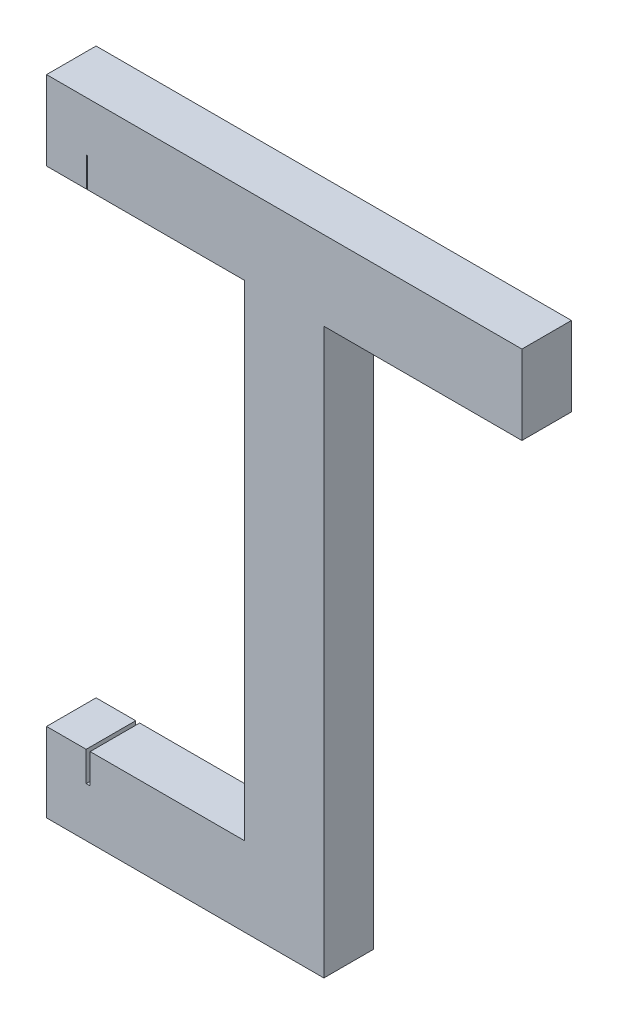
from build123d import *

# Parameters (mm, degrees)
BOSS_EXTRUDE1_DEPTH = 5
SKETCH2_W           = 0.4
SKETCH2_H           = 5
CUT_EXTRUDE1_DEPTH  = 3
SKETCH3_W           = 0.1
SKETCH3_H           = 5
CUT_EXTRUDE2_DEPTH  = 3


with BuildPart() as part:
    # Sketch1 → Boss-Extrude1 (new body)
    with BuildSketch(Plane.XY):
        Polygon((0, 65), (-28, 65), (-28, 57), (-8, 57), (-8, 8), (-28, 8), (-28, 0), (0, 0), (0, 57), (20, 57), (20, 65), align=None)
    extrude(amount=BOSS_EXTRUDE1_DEPTH)

    # Sketch2 → Cut-Extrude1 (cut)
    with BuildSketch(Plane(origin=(0, 8, 0), x_dir=(1, 0, 0), z_dir=(0, 1, 0))):
        with Locations((-23.8, -2.5)):
            Rectangle(SKETCH2_W, SKETCH2_H)
    extrude(amount=-CUT_EXTRUDE1_DEPTH, mode=Mode.SUBTRACT)

    # Sketch3 → Cut-Extrude2 (cut)
    with BuildSketch(Plane.XZ.offset(-57)):
        with Locations((-23.9, 2.5)):
            Rectangle(SKETCH3_W, SKETCH3_H)
    extrude(amount=-CUT_EXTRUDE2_DEPTH, mode=Mode.SUBTRACT)


solid = part.part
